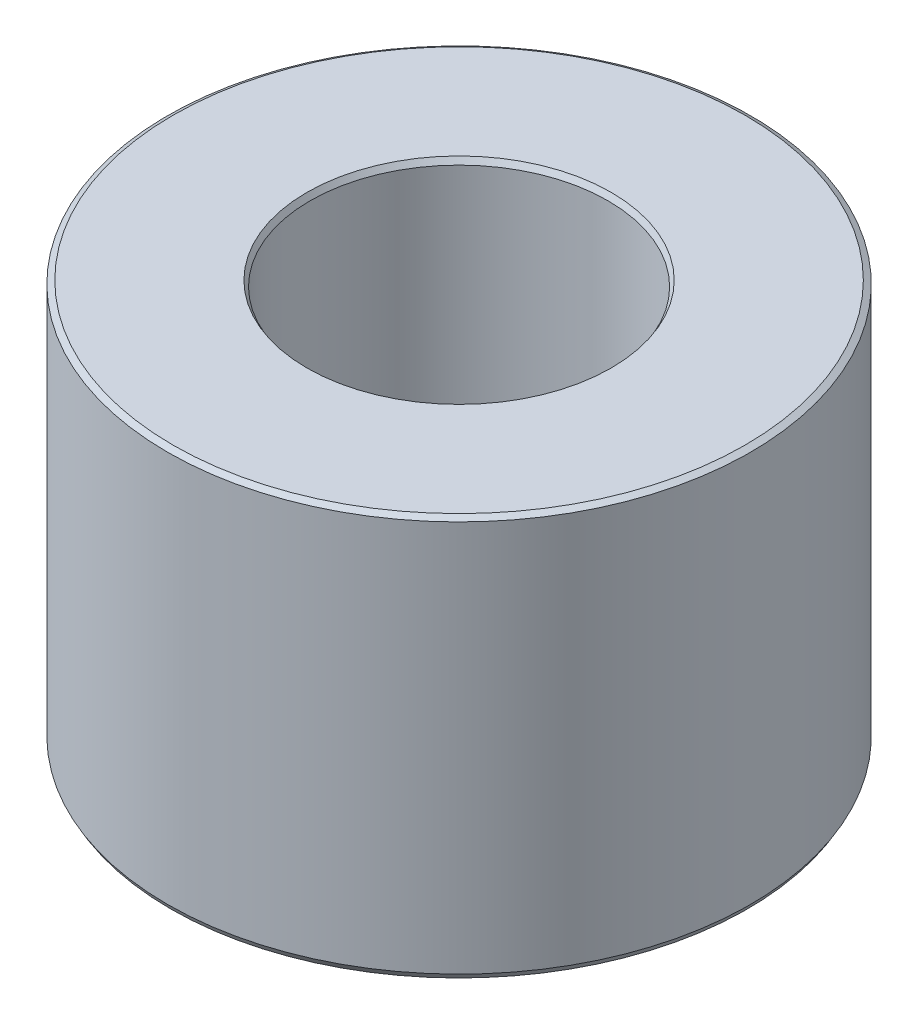
from build123d import *
from OCP.BRepFilletAPI import BRepFilletAPI_MakeChamfer

# Parameters (mm, degrees)
SKETCH1_R           = 47.5
BOSS_EXTRUDE1_DEPTH = 65.262674436
SKETCH2_R           = 24.26363134
CUT_EXTRUDE1_DEPTH  = 94.657443242
CHAMFER1_SIZE       = 0.5293305
CHAMFER1_SIZE2      = 0.916827321


with BuildPart() as part:
    # Sketch1 → Boss-Extrude1 (new body)
    with BuildSketch(Plane(origin=(0, 0, 0), x_dir=(1, 0, 0), z_dir=(0, 1, 0))):
        Circle(SKETCH1_R)
    extrude(amount=BOSS_EXTRUDE1_DEPTH)

    # Sketch2 → Cut-Extrude1 (cut, through all)
    with BuildSketch(Plane(origin=(0, 0, 0), x_dir=(1, 0, 0), z_dir=(0, 1, 0))):
        Circle(SKETCH2_R)
    extrude(amount=CUT_EXTRUDE1_DEPTH, mode=Mode.SUBTRACT)

    # Chamfer1: one chamfer whose edges measure the first distance from different faces: ONE call of the kernel's chamfer builder (chamfer() names one face for all edges)
    chamfer1_edges_1 = [part.edges().sort_by_distance(p)[0] for p in [
        (-24.26363134, 65.262674436, 0),
    ]]
    chamfer1_side_1 = [part.faces().sort_by_distance(p)[0] for p in [
        (-46.156497116, 65.262674436, 0),
    ]]
    chamfer1_edges_2 = [part.edges().sort_by_distance(p)[0] for p in [
        (-24.26363134, 0, 0),
    ]]
    chamfer1_side_2 = [part.faces().sort_by_distance(p)[0] for p in [
        (-24.26363134, 32.631337218, 0),
    ]]
    chamfer1_edges_3 = [part.edges().sort_by_distance(p)[0] for p in [
        (-47.5, 0, 0),
    ]]
    chamfer1_side_3 = [part.faces().sort_by_distance(p)[0] for p in [
        (-46.156497116, 0, 0),
    ]]
    chamfer1_edges_4 = [part.edges().sort_by_distance(p)[0] for p in [
        (-47.5, 65.262674436, 0),
    ]]
    chamfer1_side_4 = [part.faces().sort_by_distance(p)[0] for p in [
        (-47.5, 32.631337218, 0),
    ]]
    chamfer1 = BRepFilletAPI_MakeChamfer(part.part.solid().wrapped)
    for e in chamfer1_edges_1:
        chamfer1.Add(CHAMFER1_SIZE, CHAMFER1_SIZE2, e.wrapped, chamfer1_side_1[0].wrapped)  # the first distance lies on this face
    for e in chamfer1_edges_2:
        chamfer1.Add(CHAMFER1_SIZE, CHAMFER1_SIZE2, e.wrapped, chamfer1_side_2[0].wrapped)  # the first distance lies on this face
    for e in chamfer1_edges_3:
        chamfer1.Add(CHAMFER1_SIZE, CHAMFER1_SIZE2, e.wrapped, chamfer1_side_3[0].wrapped)  # the first distance lies on this face
    for e in chamfer1_edges_4:
        chamfer1.Add(CHAMFER1_SIZE, CHAMFER1_SIZE2, e.wrapped, chamfer1_side_4[0].wrapped)  # the first distance lies on this face
    add(Compound.cast(chamfer1.Shape()), mode=Mode.REPLACE)


solid = part.part
